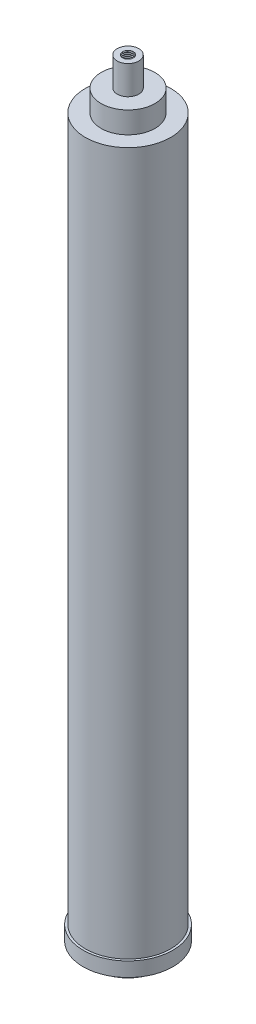
from build123d import *

# Parameters (mm, degrees)
F_3_8_0_375_DIAMETER_HOLE1_D     = 9.525
F_3_8_0_375_DIAMETER_HOLE1_DEPTH = 25.4
F_3_8_0_375_DIAMETER_HOLE1_TIP   = 2.861598698
THREAD1_PITCH                    = 1.5875


with BuildPart() as part:
    # Sketch1 → Revolve1 (revolve)
    with BuildSketch(Plane.XY, mode=Mode.PRIVATE) as revolve1_sk:
        Polygon((-37.6555, 0), (-39.6621, 0), (-39.6621, -12.7), (-27.94, -12.7), (-27.94, -21.336), (-25.4, -21.336), (-12.7, 25.4), (-12.7, 50.8), (0, 50.8), (0, 665.48), (-9.525, 665.48), (-9.525, 640.08), (-23.8125, 640.08), (-23.8125, 621.03), (-37.6555, 621.03), align=None)
    revolve(revolve1_sk.sketch.rotate(Axis((0, 50.8, 0), (0, 1, 0)), 180), axis=Axis((0, 50.8, 0), (0, 1, 0)))

    # 3/8 (0.375) Diameter Hole1
    with Locations(Plane(origin=(0, 665.48, 0), x_dir=(1, 0, 0), z_dir=(0, 1, 0))):
        with Locations((0, 0)):
            Hole(F_3_8_0_375_DIAMETER_HOLE1_D / 2, depth=F_3_8_0_375_DIAMETER_HOLE1_DEPTH)
            with Locations((0, 0, -(F_3_8_0_375_DIAMETER_HOLE1_DEPTH + F_3_8_0_375_DIAMETER_HOLE1_TIP / 2))):  # 118° drill point
                Cone(0, F_3_8_0_375_DIAMETER_HOLE1_D / 2, F_3_8_0_375_DIAMETER_HOLE1_TIP, mode=Mode.SUBTRACT)

    # Thread1: the profile of Thread Profile2 profile screwed along a right-hand helix of 16 turns, 8 arcs to a turn; built about Z, then put on its axis
    thread1_z = Axis((0, 0, 0), (0, 0, 1))
    thread1_corners = [(4.7622, 0, -0.000173205), (5.621759577, 0, 0.496093748), (5.621759577, 0, 0.694531248), (4.7622, 0, 1.190798201)]
    with BuildLine(mode=Mode.PRIVATE) as thread1_profile:
        Line(thread1_corners[0], thread1_corners[1])
        Line(thread1_corners[1], thread1_corners[2])
        Line(thread1_corners[2], thread1_corners[3])
        Line(thread1_corners[3], thread1_corners[0])
    thread1_cap = Face(thread1_profile.wire())
    thread1_turn_angles = [0, 22.5, 45, 67.5, 90, 112.5, 135, 157.5, 180, 202.5, 225, 247.5, 270, 292.5, 315, 337.5, 360]
    thread1_turn_weights = [1, 0.9238795325112867, 1, 0.9238795325112867, 1, 0.9238795325112867, 1, 0.9238795325112867, 1, 0.9238795325112867, 1, 0.9238795325112867, 1, 0.9238795325112867, 1, 0.9238795325112867, 1]
    thread1_turn_rails = [Edge.make_bspline([Vector(p[0], p[1], 0).rotate(thread1_z, thread1_turn_angles[k]) / thread1_turn_weights[k] + Vector(0, 0, p[2] + THREAD1_PITCH * thread1_turn_angles[k] / 360) for k in range(17)], [0, 0, 0, 1, 1, 2, 2, 3, 3, 4, 4, 5, 5, 6, 6, 7, 7, 8, 8, 8], 2, thread1_turn_weights) for p in thread1_corners]
    thread1_turn_sides = [Face.make_surface_from_curves(thread1_turn_rails[p[0]], thread1_turn_rails[p[1]]) for p in [(0, 1), (1, 2), (2, 3), (3, 0)]]
    thread1 = Plane(origin=(0, 665.48, 0), x_dir=(-1, 0, 0), z_dir=(0, -1, 0)) * Solid(Shell([*[p.moved(Location((0, 0, THREAD1_PITCH * i))) for i in range(16) for p in thread1_turn_sides], thread1_cap, thread1_cap.rotate(thread1_z, 5760).moved(Location((0, 0, THREAD1_PITCH * 5760 / 360)))]))
    add(thread1, mode=Mode.SUBTRACT)


solid = part.part
